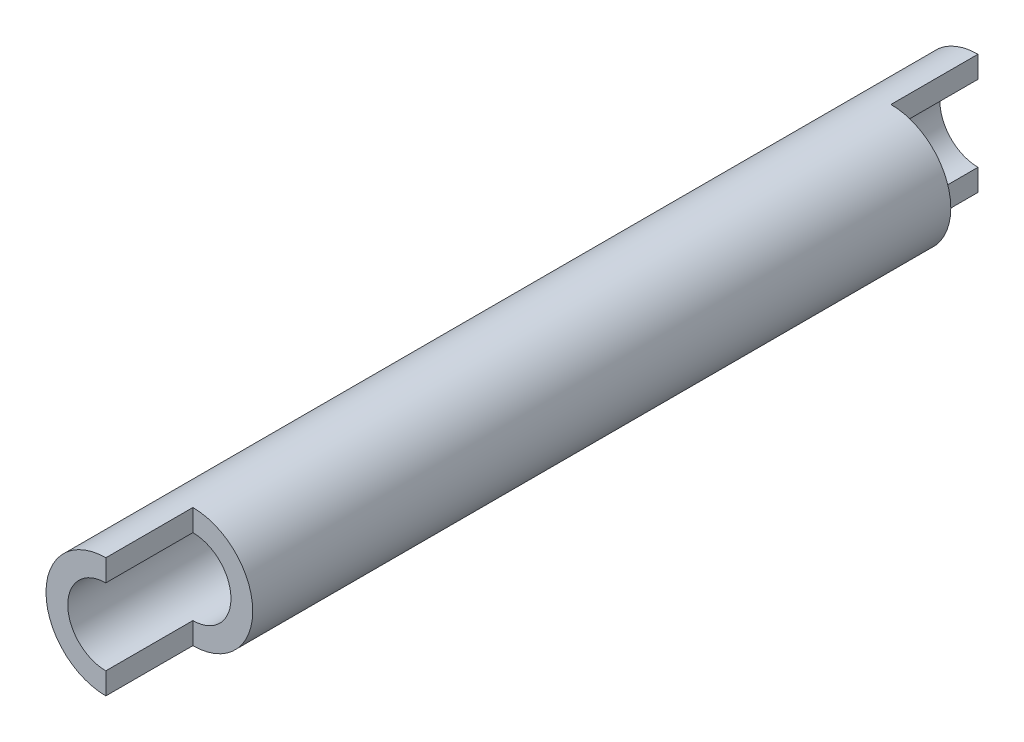
from build123d import *
from build123d.topology import SkipClean

# Parameters (mm, degrees)
SKETCH1_R                                        = 5.5
SKETCH1_R_2                                      = 3.5
BOSS_EXTRUDE1_DLUGOSC_CALKOWITA_DEPTH            = 64.16
BOSS_EXTRUDE2_PRZEDLUZENIE_DO_MONTAZU_DEPTH      = 8
BOSS_EXTRUDE2_PRZEDLUZENIE_DO_MONTAZU_DEPTH_BACK = 72.16


with BuildPart() as part:
    # Sketch1 → Boss-Extrude1 dlugosc calkowita (new body)
    with BuildSketch(Plane.XY):
        Circle(SKETCH1_R)
        Circle(SKETCH1_R_2, mode=Mode.SUBTRACT)
    extrude(amount=BOSS_EXTRUDE1_DLUGOSC_CALKOWITA_DEPTH)

    # Sketch2 → Boss-Extrude2 przedluzenie do montazu (add, two sides: drawn at the far end of the back side and taken through both)
    with SkipClean():  # the faces are left unmerged after this step: merging them gives an invalid solid
        with BuildSketch(Plane(origin=(0, 0, 0), x_dir=(-1, 0, 0), z_dir=(0, 0, -1)).offset(-BOSS_EXTRUDE2_PRZEDLUZENIE_DO_MONTAZU_DEPTH_BACK)):
            with BuildLine():
                Line((0, 5.5), (0, 3.5))
                ThreePointArc((0, 3.5), (3.5, 0), (0, -3.5))
                Line((0, -3.5), (0, -5.5))
                ThreePointArc((0, -5.5), (5.5, 0), (0, 5.5))
            make_face()
        extrude(amount=BOSS_EXTRUDE2_PRZEDLUZENIE_DO_MONTAZU_DEPTH + BOSS_EXTRUDE2_PRZEDLUZENIE_DO_MONTAZU_DEPTH_BACK)
    add(part.part.scale(1), mode=Mode.REPLACE)  # the faces are merged on a copy


solid = part.part
